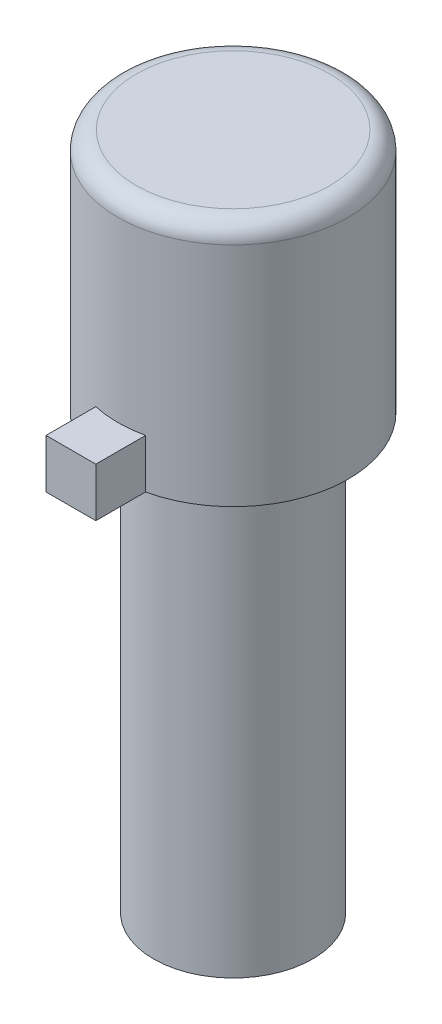
from build123d import *

# Parameters (mm, degrees)
SKETCH1_R           = 3.25
BOSS_EXTRUDE1_DEPTH = 17.686
SKETCH6_R           = 4.7
BOSS_EXTRUDE2_DEPTH = 10
FILLET1_R           = 0.75
BOSS_EXTRUDE3_DEPTH = 2


with BuildPart() as part:
    # Sketch1 → Boss-Extrude1 (new body)
    with BuildSketch(Plane(origin=(0, 0, 0), x_dir=(1, 0, 0), z_dir=(0, 1, 0))):
        Circle(SKETCH1_R)
    extrude(amount=BOSS_EXTRUDE1_DEPTH)

    # Sketch6 → Boss-Extrude2 (add)
    with BuildSketch(Plane(origin=(0, 17.686, 0), x_dir=(1, 0, 0), z_dir=(0, 1, 0))):
        Circle(SKETCH6_R)
    extrude(amount=BOSS_EXTRUDE2_DEPTH)

    # Fillet1
    fillet1_edges = [part.edges().sort_by_distance(p)[0] for p in [
        (-4.7, 27.686, 0),
    ]]
    fillet(fillet1_edges, radius=FILLET1_R)

    # Sketch7 → Boss-Extrude3 (add)
    with BuildSketch(Plane.XZ.offset(-17.686)):
        with BuildLine():
            Line((-1.016, 4.588871757), (-1.016, 6.620871757))
            Line((-1.016, 6.620871757), (1.016, 6.620871757))
            Line((1.016, 6.620871757), (1.016, 4.588871757))
            ThreePointArc((1.016, 4.588871757), (0, 4.7), (-1.016, 4.588871757))
        make_face()
    extrude(amount=-BOSS_EXTRUDE3_DEPTH)


solid = part.part
